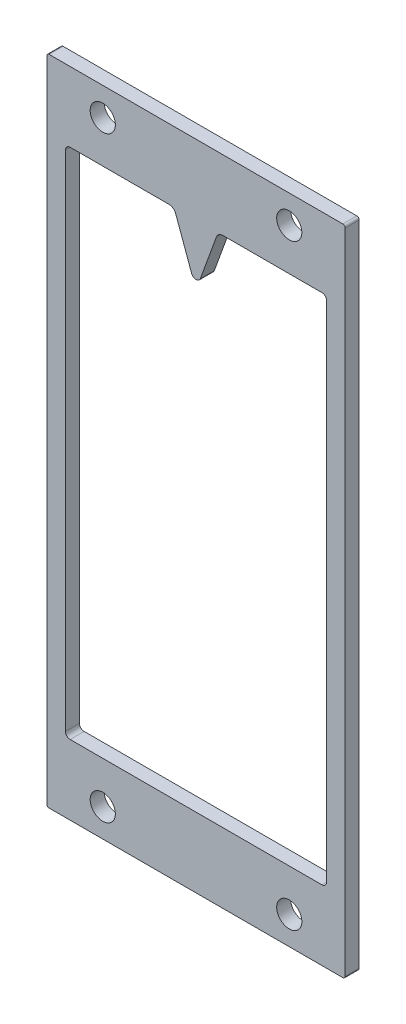
from build123d import *

# Parameters (mm, degrees)
SKETCH1_W           = 64
SKETCH1_H           = 140
SKETCH1_R           = 2.699339217
BOSS_EXTRUDE1_DEPTH = 3
FILLET1_R           = 1.5
FILLET2_R           = 0.5
FILLET3_R           = 1


with BuildPart() as part:
    # Sketch1 → Boss-Extrude1 (new body)
    with BuildSketch(Plane.XY):
        with Locations((28, -55)):
            Rectangle(SKETCH1_W, SKETCH1_H)
        with Locations((8, 9)):
            Circle(SKETCH1_R, mode=Mode.SUBTRACT)
        with Locations((48, 9)):
            Circle(SKETCH1_R, mode=Mode.SUBTRACT)
        with Locations((48, -119)):
            Circle(SKETCH1_R, mode=Mode.SUBTRACT)
        with Locations((8, -119)):
            Circle(SKETCH1_R, mode=Mode.SUBTRACT)
        with BuildLine():
            Line((0, 0), (23.268386955, 0))
            Line((23.268386955, 0), (27.060307379, -10.418215743))
            ThreePointArc((27.060307379, -10.418215743), (28, -11.0761956), (28.939692621, -10.418215743))
            Line((28.939692621, -10.418215743), (32.731613045, 0))
            Line((32.731613045, 0), (56, 0))
            Line((56, 0), (56, -110))
            Line((56, -110), (0, -110))
            Line((0, -110), (0, 0))
        make_face(mode=Mode.SUBTRACT)
    extrude(amount=BOSS_EXTRUDE1_DEPTH)

    # Fillet1
    fillet1_edges = [part.edges().sort_by_distance(p)[0] for p in [
        (23.268386955, 0, 1.5),
        (32.731613045, 0, 1.5),
    ]]
    fillet(fillet1_edges, radius=FILLET1_R)

    # Fillet2
    fillet2_edges = [part.edges().sort_by_distance(p)[0] for p in [
        (60, -125, 1.5),
        (-4, -125, 1.5),
        (60, 15, 1.5),
        (-4, 15, 1.5),
    ]]
    fillet(fillet2_edges, radius=FILLET2_R)

    # Fillet3
    fillet3_edges = [part.edges().sort_by_distance(p)[0] for p in [
        (0, -110, 1.5),
        (56, -110, 1.5),
        (56, 0, 1.5),
        (0, 0, 1.5),
    ]]
    fillet(fillet3_edges, radius=FILLET3_R)


solid = part.part
